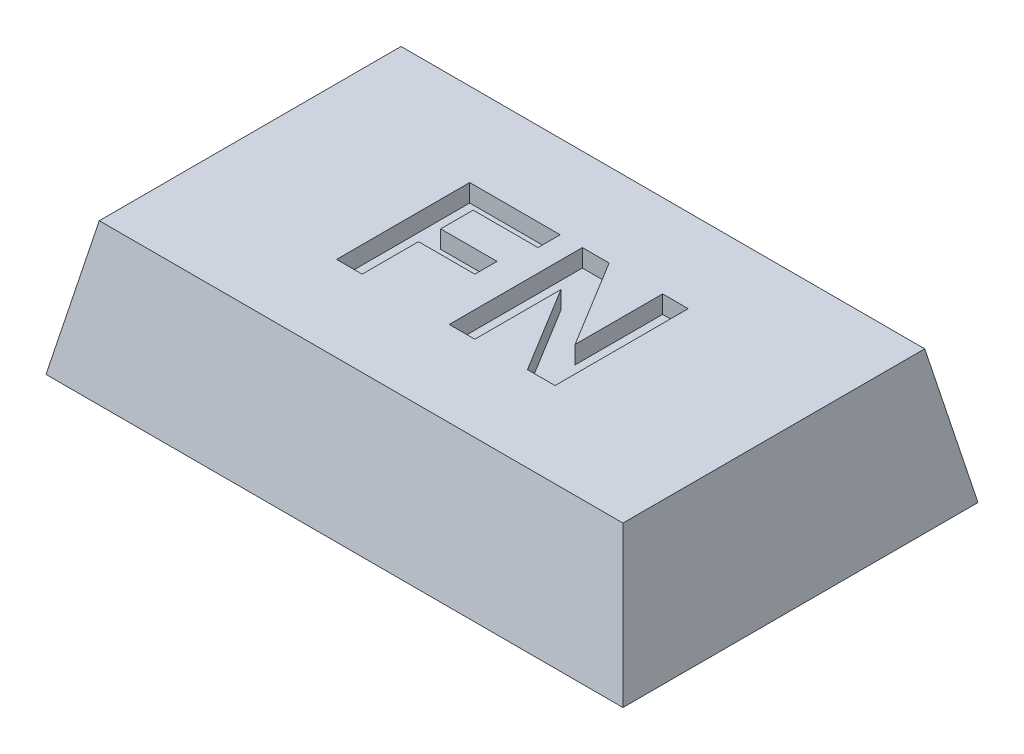
from build123d import *

# Parameters (mm, degrees)
SKETCH1_W               = 13
SKETCH1_H               = 8
BOSS_EXTRUDE1_DEPTH     = 3
CUT_EXTRUDE1_DEPTH      = 16.556349186
CUT_EXTRUDE1_DEPTH_BACK = 16.556349186
CUT_EXTRUDE2_DEPTH      = 16.556349186
CUT_EXTRUDE2_DEPTH_BACK = 16.556349186
SKETCH4_R               = 1.8
CUT_EXTRUDE3_DEPTH      = 0.8
SKETCH5_W               = 8
SKETCH5_H               = 1.1
BOSS_EXTRUDE2_DEPTH     = 2
FILLET1_R               = 4
CUT_EXTRUDE4_DEPTH      = 0.4


with BuildPart() as part:
    # Sketch1 → Boss-Extrude1 (new body)
    with BuildSketch(Plane(origin=(0, 0, 0), x_dir=(1, 0, 0), z_dir=(0, 1, 0))):
        with Locations((6.5, 4)):
            Rectangle(SKETCH1_W, SKETCH1_H)
    extrude(amount=BOSS_EXTRUDE1_DEPTH)

    # Sketch2 → Cut-Extrude1 (cut, two sides: drawn at the far end of the back side and taken through both)
    with BuildSketch(Plane.XY.offset(-CUT_EXTRUDE1_DEPTH_BACK)):
        Polygon((0, 0), (0.6, 3), (0, 3), align=None)
        Polygon((13, 0), (12.4, 3), (13, 3), align=None)
    extrude(amount=CUT_EXTRUDE1_DEPTH + CUT_EXTRUDE1_DEPTH_BACK, mode=Mode.SUBTRACT)

    # Sketch3 → Cut-Extrude2 (cut, two sides: drawn at the far end of the back side and taken through both)
    with BuildSketch(Plane(origin=(0, 0, 0), x_dir=(0, 0, -1), z_dir=(1, 0, 0)).offset(-CUT_EXTRUDE2_DEPTH_BACK)):
        Polygon((0, 0), (0.6, 3), (0, 3), align=None)
        Polygon((8, 3), (7.4, 3), (8, 0), align=None)
    extrude(amount=CUT_EXTRUDE2_DEPTH + CUT_EXTRUDE2_DEPTH_BACK, mode=Mode.SUBTRACT)

    # Sketch4 → Cut-Extrude3 (cut)
    with BuildSketch(Plane.XZ):
        with Locations(Location((6.50000125, -3.75, 0), (0, 0, 270))):
            Circle(SKETCH4_R)
    extrude(amount=-CUT_EXTRUDE3_DEPTH, mode=Mode.SUBTRACT)

    # Sketch5 → Boss-Extrude2 (add)
    with BuildSketch(Plane.XZ):
        with Locations((6.500011, -7.45)):
            Rectangle(SKETCH5_W, SKETCH5_H)
    extrude(amount=BOSS_EXTRUDE2_DEPTH)

    # Fillet1
    # the kernel refuses this fillet: 4 mm, written as the material it takes off along each edge
    with BuildSketch(Plane(origin=(10.500011, -2, -16.660254038), x_dir=(0, 1, 0), z_dir=(0, 0, 1)), Plane(origin=(2.500011, -2, 1.760254038), x_dir=(0, 1, 0), z_dir=(0, 0, -1))) as fillet1_piece_1:
        with BuildLine():
            CenterArc((4, 3.464101615), FILLET1_R, 180, 60)
            Line((0, 3.464101615), (-0.08, 3.464101615))
            Line((-0.08, 3.464101615), (-0.08, 0))
            Line((-0.08, 0), (0, -0.08))
            ThreePointArc((0, -0.08), (1, -0.08), (1.96, -0.069282032))
            Line((1.96, -0.069282032), (2, 0))
        make_face()
    extrude(amount=18.420508076, mode=Mode.SUBTRACT)

    # Sketch6 → Cut-Extrude4 (cut)
    with BuildSketch(Plane(origin=(0, 3, 0), x_dir=(1, 0, 0), z_dir=(0, 1, 0))):
        Polygon((4.028737707, 2.518536397), (4.028737707, 5.518536397), (6.067199245, 5.518536397), (6.067199245, 5.018536397), (4.605660784, 5.018536397), (4.605660784, 4.287767167), (5.874891553, 4.287767167), (5.874891553, 3.787767167), (4.605660784, 3.787767167), (4.605660784, 2.518536397), align=None)
        Polygon((6.567199245, 2.518536397), (6.567199245, 5.518536397), (7.169963668, 5.518536397), (8.374891553, 3.546180628), (8.374891553, 5.518536397), (8.95181463, 5.518536397), (8.95181463, 2.518536397), (8.330420399, 2.518536397), (7.144122322, 4.459642167), (7.144122322, 2.518536397), align=None)
    extrude(amount=-CUT_EXTRUDE4_DEPTH, mode=Mode.SUBTRACT)


solid = part.part
